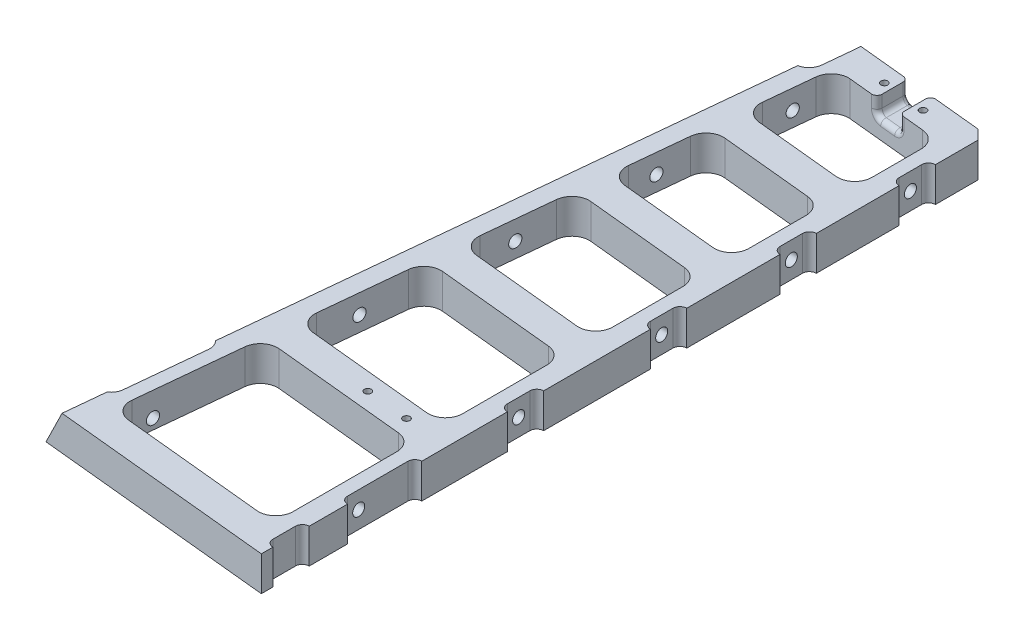
from build123d import *

# Parameters (mm, degrees)
BOSS_EXTRUDE1_DEPTH          = 20
CUT_EXTRUDE1_DEPTH           = 454.597244545
SKETCH4_R                    = 21.143070137
SKETCH4_R_2                  = 24.508135688
SKETCH4_R_3                  = 28.225341501
SKETCH4_R_4                  = 32.331537606
SKETCH4_R_5                  = 36.867430236
LIGHTENING_HOLES_DEPTH       = 452.905665517
CUT_EXTRUDE3_DEPTH           = 452.905665517
FILLET2_R                    = 10
CUT_EXTRUDE4_DEPTH           = 452.905665517
SKETCH8_R                    = 3.5
CUT_EXTRUDE5_DEPTH           = 15
SKETCH9_R                    = 3.5
CUT_EXTRUDE6_DEPTH           = 15
SKETCH10_W                   = 15
SKETCH10_H                   = 35.199564684
CUT_EXTRUDE7_DEPTH           = 10
SKETCH12_R                   = 2
CUT_EXTRUDE8_DEPTH           = 451.385763243
FILLET3_R                    = 3
F_9_0_9_DIAMETER_HOLE1_D     = 9
F_9_0_9_DIAMETER_HOLE1_DEPTH = 10
F_9_0_9_DIAMETER_HOLE1_TIP   = 2.703872786
CHAMFER1_SIZE                = 5
CHAMFER1_SIZE2               = 5.58200296
CUT_EXTRUDE9_DEPTH           = 20


with BuildPart() as part:
    # Sketch1 → Boss-Extrude1 (new body)
    with BuildSketch(Plane(origin=(0, 0, 0), x_dir=(1, 0, 0), z_dir=(0, 1, 0))):
        Polygon((-138.529343985, 13.827066741), (0, 0), (0, 420), (-97.021302505, 429.684013411), align=None)
    extrude(amount=BOSS_EXTRUDE1_DEPTH)

    # Sketch3 → Cut-Extrude1 (cut, through all)
    with BuildSketch(Plane(origin=(41.50804148, 0, -415.856946671), x_dir=(-0.9950555699612278, 0, -0.09931974974362369), z_dir=(0.09931974974362369, 0, -0.9950555699612278))):
        Polygon((128.837391555, 20), (139.217696143, 0), (139.217696143, 20), align=None)
    extrude(amount=-CUT_EXTRUDE1_DEPTH, mode=Mode.SUBTRACT)

    # Sketch4 → lightening holes (cut, through all)
    with BuildSketch(Plane(origin=(0, 20, 0), x_dir=(1, 0, 0), z_dir=(0, 1, 0))):
        with Locations((-45.602733508, 381.166929651)):
            Circle(SKETCH4_R)
        with Locations((-48.967799059, 313.572188545)):
            Circle(SKETCH4_R_2)
        with Locations((-52.685004872, 238.903935942)):
            Circle(SKETCH4_R_3)
        with Locations((-56.791200977, 156.42195797)):
            Circle(SKETCH4_R_4)
        with Locations((-61.327093607, 65.308580424)):
            Circle(SKETCH4_R_5)
    extrude(amount=-LIGHTENING_HOLES_DEPTH, mode=Mode.SUBTRACT)

    # Sketch6 → Cut-Extrude3 (cut, through all)
    with BuildSketch(Plane(origin=(0, 20, 0), x_dir=(1, 0, 0), z_dir=(0, 1, 0))):
        Polygon((-12, 403.108317253), (-77.607492761, 409.656815608), (-82.403216885, 361.609856029), (-12, 354.582680771), align=None)
        Polygon((-12, 336.490165562), (-84.191276104, 343.695812857), (-89.450470533, 291.005479627), (-12, 283.274894941), align=None)
        Polygon((-12, 265.182379732), (-91.238529751, 273.091436454), (-97.23528121, 213.011734724), (-12, 204.504122632), align=None)
        Polygon((-12, 186.411607423), (-99.023340428, 195.097691551), (-105.826996451, 126.93384862), (-12, 117.568669339), align=None)
        Polygon((-12, 19.290274443), (-115.539719527, 29.624912369), (-107.61505567, 109.019805447), (-12, 99.47615413), align=None)
    extrude(amount=-CUT_EXTRUDE3_DEPTH, mode=Mode.SUBTRACT)

    # Fillet2
    fillet2_edges = [part.edges().sort_by_distance(p)[0] for p in [
        (-82.403216885, 10, -361.609856029),
        (-89.450470533, 10, -291.005479627),
        (-105.826996451, 10, -126.93384862),
        (-97.23528121, 10, -213.011734724),
        (-115.539719527, 10, -29.624912369),
        (-107.61505567, 10, -109.019805447),
        (-99.023340428, 10, -195.097691551),
        (-91.238529751, 10, -273.091436454),
        (-84.191276104, 10, -343.695812857),
        (-77.607492761, 10, -409.656815608),
        (-12, 10, -99.47615413),
        (-12, 10, -19.290274443),
        (-12, 10, -117.568669339),
        (-12, 10, -204.504122632),
        (-12, 10, -283.274894941),
        (-12, 10, -354.582680771),
        (-12, 10, -186.411607423),
        (-12, 10, -265.182379732),
        (-12, 10, -336.490165562),
        (-12, 10, -403.108317253),
    ]]
    fillet(fillet2_edges, radius=FILLET2_R)

    # Sketch7 → Cut-Extrude4 (cut, through all)
    with BuildSketch(Plane(origin=(0, 20, 0), x_dir=(1, 0, 0), z_dir=(0, 1, 0))):
        with BuildLine():
            Line((4, 386.343631707), (4, 373.343631707))
            ThreePointArc((4, 373.343631707), (0, 369.343631707), (-4, 373.343631707))
            Line((-4, 373.343631707), (-4, 386.343631707))
            ThreePointArc((-4, 386.343631707), (0, 390.343631707), (4, 386.343631707))
        make_face()
        with BuildLine():
            Line((-90.972344794, 400.006849206), (-93.22098734, 377.478356168))
            ThreePointArc((-93.22098734, 377.478356168), (-94.867371238, 375.690136117), (-97.245059875, 375.185252334))
            Line((-97.245059875, 375.185252334), (-103.45294363, 375.804881508))
            Line((-103.45294363, 375.804881508), (-97.274285682, 437.707051244))
            Line((-97.274285682, 437.707051244), (-86.896049311, 434.941992628))
            ThreePointArc((-86.896049311, 434.941992628), (-82.377737412, 431.764819027), (-80.995187492, 426.417097061))
            Line((-80.995187492, 426.417097061), (-82.902168027, 407.311615945))
            ThreePointArc((-82.902168027, 407.311615945), (-85.506847748, 402.149631141), (-90.902005618, 400.070517115))
            ThreePointArc((-90.902005618, 400.070517115), (-90.949442951, 400.052236348), (-90.972344794, 400.006849206))
        make_face()
        with BuildLine():
            Line((-125.915872804, 96.05751336), (-148.650180867, 101.436194836))
            Line((-148.650180867, 101.436194836), (-151.063370411, 35.046485714))
            Line((-151.063370411, 35.046485714), (-130.385261543, 35.046485714))
            ThreePointArc((-130.385261543, 35.046485714), (-124.938313734, 37.145557856), (-122.308630813, 42.357094293))
            Line((-122.308630813, 42.357094293), (-117.839242075, 87.134594941))
            ThreePointArc((-117.839242075, 87.134594941), (-119.898181448, 93.38769767), (-125.915872804, 96.05751336))
        make_face()
        with BuildLine():
            Line((-98.391920344, 323.421228448), (-99.683077091, 310.485506038))
            ThreePointArc((-99.683077091, 310.485506038), (-101.12977588, 307.787424198), (-104.06057837, 306.902562757))
            Line((-104.06057837, 306.902562757), (-111.476610532, 307.408479891))
            Line((-111.476610532, 307.408479891), (-109.390895788, 327.818507447))
            Line((-109.390895788, 327.818507447), (-102.372142624, 327.818507447))
            ThreePointArc((-102.372142624, 327.818507447), (-99.406580621, 326.502802885), (-98.391920344, 323.421228448))
        make_face()
        with BuildLine():
            Line((-105.807952507, 249.122167795), (-107.099109253, 236.186445385))
            ThreePointArc((-107.099109253, 236.186445385), (-108.545808043, 233.488363545), (-111.476610532, 232.603502104))
            Line((-111.476610532, 232.603502104), (-119.024523686, 232.918300983))
            Line((-119.024523686, 232.918300983), (-116.895464365, 254.248724599))
            Line((-116.895464365, 254.248724599), (-109.390895788, 253.499669074))
            ThreePointArc((-109.390895788, 253.499669074), (-106.692813948, 252.052970284), (-105.807952507, 249.122167795))
        make_face()
        with BuildLine():
            Line((-113.996215466, 167.086352291), (-115.287372213, 154.150629882))
            ThreePointArc((-115.287372213, 154.150629882), (-116.734071002, 151.452548042), (-119.664873491, 150.567686601))
            Line((-119.664873491, 150.567686601), (-128.02613811, 151.153836386))
            Line((-128.02613811, 151.153836386), (-125.915872804, 172.295968257))
            Line((-125.915872804, 172.295968257), (-117.579158747, 171.46385357))
            ThreePointArc((-117.579158747, 171.46385357), (-114.881076907, 170.017154781), (-113.996215466, 167.086352291))
        make_face()
        with BuildLine():
            Line((4, 66.881346981), (4, 53.881346981))
            ThreePointArc((4, 53.881346981), (0, 49.881346981), (-4, 53.881346981))
            Line((-4, 53.881346981), (-4, 66.881346981))
            ThreePointArc((-4, 66.881346981), (0, 70.881346981), (4, 66.881346981))
        make_face()
        with BuildLine():
            Line((4, 159.488271076), (4, 146.488271076))
            ThreePointArc((4, 146.488271076), (0, 142.488271076), (-4, 146.488271076))
            Line((-4, 146.488271076), (-4, 159.488271076))
            ThreePointArc((-4, 159.488271076), (0, 163.488271076), (4, 159.488271076))
        make_face()
        with BuildLine():
            Line((4, 242.341383877), (4, 229.341383877))
            ThreePointArc((4, 229.341383877), (0, 225.341383877), (-4, 229.341383877))
            Line((-4, 229.341383877), (-4, 242.341383877))
            ThreePointArc((-4, 242.341383877), (0, 246.341383877), (4, 242.341383877))
        make_face()
        with BuildLine():
            Line((4, 317.380662946), (4, 304.380662946))
            ThreePointArc((4, 304.380662946), (0, 300.380662946), (-4, 304.380662946))
            Line((-4, 304.380662946), (-4, 317.380662946))
            ThreePointArc((-4, 317.380662946), (0, 321.380662946), (4, 317.380662946))
        make_face()
        with BuildLine():
            Line((-4, 10.731424106), (-4, 23.731424106))
            ThreePointArc((-4, 23.731424106), (0, 27.731424106), (4, 23.731424106))
            Line((4, 23.731424106), (4, 10.731424106))
            ThreePointArc((4, 10.731424106), (0, 6.731424106), (-4, 10.731424106))
        make_face()
    extrude(amount=-CUT_EXTRUDE4_DEPTH, mode=Mode.SUBTRACT)

    # Sketch8 → Cut-Extrude5 (cut)
    with BuildSketch(Plane(origin=(-4, 0, 0), x_dir=(0, 0, -1), z_dir=(1, 0, 0))):
        with Locations((379.843631707, 10)):
            Circle(SKETCH8_R)
        with Locations((310.880662946, 10)):
            Circle(SKETCH8_R)
        with Locations((235.841383877, 10)):
            Circle(SKETCH8_R)
        with Locations((152.988271076, 10)):
            Circle(SKETCH8_R)
        with Locations((60.381346981, 10)):
            Circle(SKETCH8_R)
    extrude(amount=-CUT_EXTRUDE5_DEPTH, mode=Mode.SUBTRACT)

    # Sketch9 → Cut-Extrude6 (cut)
    with BuildSketch(Plane(origin=(-129.607101015, 0, -12.936508499), x_dir=(-0.09931974974363122, 0, 0.9950555699612271), z_dir=(-0.9950555699612271, 0, -0.09931974974363121))):
        with Locations((-377.673474259, 8.638067899)):
            Circle(SKETCH9_R)
        with Locations((-305.549833905, 8.853451472)):
            Circle(SKETCH9_R)
        with Locations((-230.881581301, 8.853451472)):
            Circle(SKETCH9_R)
        with Locations((-148.43812992, 8.853451472)):
            Circle(SKETCH9_R)
        with Locations((-39.157729957, 6)):
            Circle(SKETCH9_R)
    extrude(amount=-CUT_EXTRUDE6_DEPTH, mode=Mode.SUBTRACT)

    # Sketch10 → Cut-Extrude7 (cut)
    with BuildSketch(Plane(origin=(0, 20, 0), x_dir=(1, 0, 0), z_dir=(0, 1, 0))):
        with Locations((-43.3, 415.994324334)):
            Rectangle(SKETCH10_W, SKETCH10_H)
    extrude(amount=-CUT_EXTRUDE7_DEPTH, mode=Mode.SUBTRACT)

    # Sketch12 → Cut-Extrude8 (cut, through all)
    with BuildSketch(Plane(origin=(0, 20, 0), x_dir=(1, 0, 0), z_dir=(0, 1, 0))):
        with Locations((-30.861805375, 414.035696706)):
            Circle(SKETCH12_R)
        with Locations((-55.738194625, 416.51869045)):
            Circle(SKETCH12_R)
        with Locations((-25.861805375, 109.90600385)):
            Circle(SKETCH12_R)
        with Locations((-50.738194625, 112.388997593)):
            Circle(SKETCH12_R)
    extrude(amount=-CUT_EXTRUDE8_DEPTH, mode=Mode.SUBTRACT)

    # Fillet3
    fillet3_edges = [part.edges().sort_by_distance(p)[0] for p in [
        (-35.8, 15, -405.483873067),
        (-50.8, 15, -406.981072109),
        (-50.8, 15, -425.070514089),
        (-35.8, 10, -414.528594057),
        (-43.3, 10, -406.232472588),
        (-50.8, 10, -416.025793099),
        (-43.3, 10, -424.321914568),
        (-35.8, 15, -423.573315047),
    ]]
    fillet(fillet3_edges, radius=FILLET3_R)

    # Ø9.0 (9) Diameter Hole1
    with Locations(Plane(origin=(0, 0, 0), x_dir=(-1, 0, 0), z_dir=(0, -1, 0))):
        with Locations((55.738194625, 416.51869045), (30.861805375, 414.035696706), (50.738194625, 112.388997593), (25.861805375, 109.90600385)):
            Hole(F_9_0_9_DIAMETER_HOLE1_D / 2, depth=F_9_0_9_DIAMETER_HOLE1_DEPTH)
            with Locations((0, 0, -(F_9_0_9_DIAMETER_HOLE1_DEPTH + F_9_0_9_DIAMETER_HOLE1_TIP / 2))):  # 118° drill point
                Cone(0, F_9_0_9_DIAMETER_HOLE1_D / 2, F_9_0_9_DIAMETER_HOLE1_TIP, mode=Mode.SUBTRACT)

    # Chamfer1
    chamfer1_edges = [part.edges().sort_by_distance(p)[0] for p in [
        (0, 10, -420),
    ]]
    chamfer1_side = [part.faces().sort_by_distance(p)[0] for p in [
        (0, 10, -405.171815853),
    ]]
    chamfer(chamfer1_edges, length=CHAMFER1_SIZE, length2=CHAMFER1_SIZE2, reference=chamfer1_side[0])

    # Sketch16 → Cut-Extrude9 (cut)
    with BuildSketch(Plane(origin=(0, 20, 0), x_dir=(1, 0, 0), z_dir=(0, 1, 0))):
        with BuildLine():
            Line((-4, 53.881346981), (-4, 88.881346981))
            ThreePointArc((-4, 88.881346981), (0, 92.881346981), (4, 88.881346981))
            Line((4, 88.881346981), (4, 53.881346981))
            ThreePointArc((4, 53.881346981), (0, 49.881346981), (-4, 53.881346981))
        make_face()
    extrude(amount=-CUT_EXTRUDE9_DEPTH, mode=Mode.SUBTRACT)


solid = part.part
